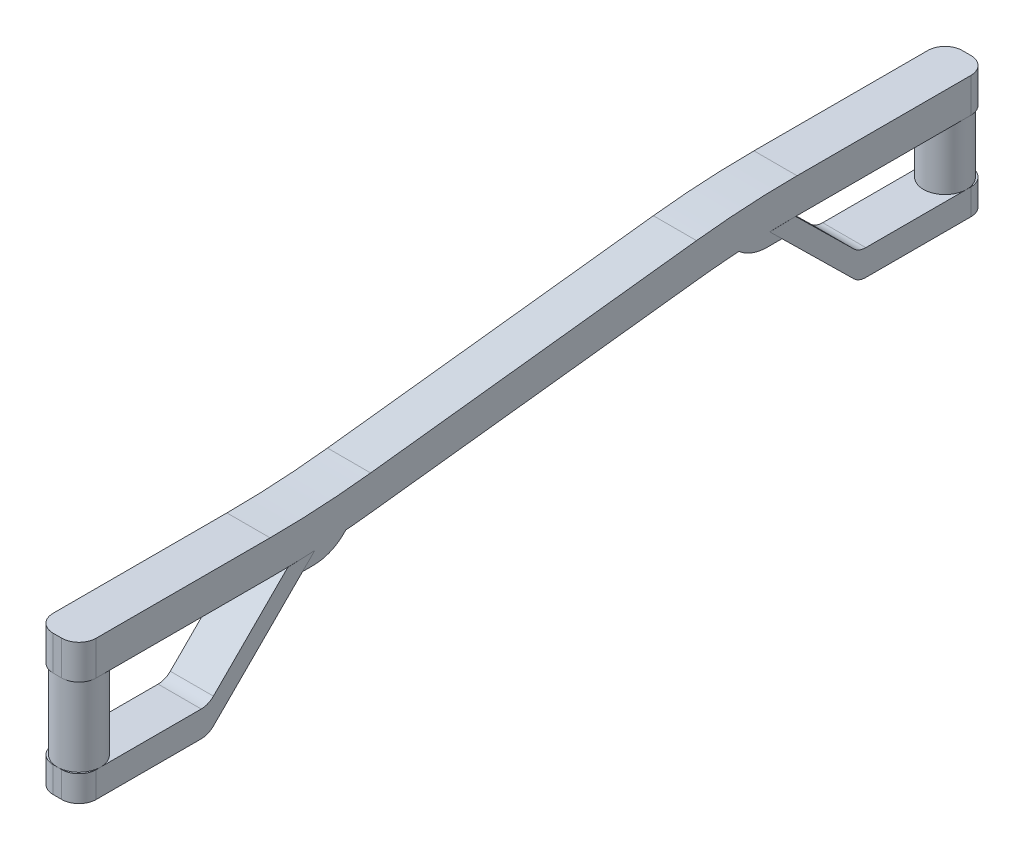
from build123d import *

# Parameters (mm, degrees)
SKETCH1_W             = 5
SKETCH1_H             = 105.4
BOSS_EXTRUDE1_DEPTH   = 4
SKETCH1_3_R           = 2.5
BOSS_EXTRUDE2_DEPTH   = 15
SKETCH1_4_R           = 2.5
BOSS_EXTRUDE3_DEPTH   = 7.2
FILLET1_R             = 1
CUT_EXTRUDE1_DEPTH    = 7
CUT_EXTRUDE2_DEPTH    = 7
BOSS_EXTRUDE4_DEPTH   = 5
CUT_EXTRUDE3_DEPTH    = 5
FILLET2_R             = 100
BOSS_EXTRUDE6_DEPTH   = 5
BOSS_EXTRUDE6_2_DEPTH = 5
BOSS_EXTRUDE7_DEPTH   = 5
FILLET3_R             = 5
FILLET4_R             = 2
FILLET5_R             = 2
FILLET6_R             = 2


with BuildPart() as part:
    # Sketch1 → Boss-Extrude1 (new body)
    with BuildSketch(Plane(origin=(0, 0, 0), x_dir=(1, 0, 0), z_dir=(0, 1, 0))):
        with Locations((-2.5, -52.7)):
            Rectangle(SKETCH1_W, SKETCH1_H)
    extrude(amount=BOSS_EXTRUDE1_DEPTH)

    # Sketch1<3> → Boss-Extrude2 (add)
    with BuildSketch(Plane(origin=(0, 0, 0), x_dir=(1, 0, 0), z_dir=(0, 1, 0))):
        with Locations(Location((-2.5, -102.9, 0), (0, 0, 270))):
            Circle(SKETCH1_3_R)
    extrude(amount=-BOSS_EXTRUDE2_DEPTH)

    # Sketch1<4> → Boss-Extrude3 (add)
    with BuildSketch(Plane(origin=(0, 0, 0), x_dir=(1, 0, 0), z_dir=(0, 1, 0))):
        with Locations(Location((-2.5, -2.5, 0), (0, 0, 270))):
            Circle(SKETCH1_4_R)
    extrude(amount=-BOSS_EXTRUDE3_DEPTH)

    # Fillet1
    fillet1_edges = [part.edges().sort_by_distance(p)[0] for p in [
        (0, 2, 105.4),
        (-5, 2, 105.4),
    ]]
    fillet(fillet1_edges, radius=FILLET1_R)

    # Sketch2 → Cut-Extrude1 (cut)
    with BuildSketch(Plane.XZ.offset(15)):
        Polygon((-1.833333333, 104.054700538), (-1.833333333, 101.745299462), (-3.833333333, 102.9), align=None)
    extrude(amount=-CUT_EXTRUDE1_DEPTH, mode=Mode.SUBTRACT)

    # Sketch3 → Cut-Extrude2 (cut)
    with BuildSketch(Plane(origin=(0, -7.2, 0), x_dir=(-1, 0, 0), z_dir=(0, -1, 0))):
        Polygon((3.166666667, -1.345299462), (3.166666667, -3.654700538), (1.166666667, -2.5), align=None)
    extrude(amount=-CUT_EXTRUDE2_DEPTH, mode=Mode.SUBTRACT)

    # Sketch4 → Boss-Extrude4 (add)
    with BuildSketch(Plane.ZY.offset(5)):
        Polygon((105.4, -5.8), (105.4, -1.8), (77.4, -1.8), (28, 4), (28, 0), (77.4, -5.8), align=None)
    extrude(amount=-BOSS_EXTRUDE4_DEPTH)

    # Sketch4<4> → Cut-Extrude3 (cut)
    with BuildSketch(Plane.ZY.offset(5)):
        Polygon((77.4, -1.8), (105.4, -1.8), (105.4, 4), (28, 4), align=None)
    extrude(amount=-CUT_EXTRUDE3_DEPTH, mode=Mode.SUBTRACT)

    # Fillet2
    fillet2_edges = [part.edges().sort_by_distance(p)[0] for p in [
        (-2.5, 4, 28),
        (-2.5, -1.8, 77.4),
        (-2.5, -5.8, 77.4),
        (-2.5, 0, 28),
    ]]
    fillet(fillet2_edges, radius=FILLET2_R)

    # Sketch6 → Boss-Extrude7 (add)
    with BuildSketch(Plane(origin=(0, 0, 0), x_dir=(0, 0, -1), z_dir=(1, 0, 0))):
        Polygon((-74.479709397, -5.414636547), (-78.065495835, -5.665495835), (-79.479709397, -7.079709397), (-74.479709397, -7.079709397), align=None)
        with BuildLine():
            ThreePointArc((-25.320806157, -0.050293893), (-27.108607835, -0.123032137), (-28.89482189, -0.227746249))
            Line((-28.89482189, -0.227746249), (-28.89482189, -1.452637955))
            Line((-28.89482189, -1.452637955), (-23.89482189, -1.452637955))
            Line((-23.89482189, -1.452637955), (-25.320806157, -0.050293893))
        make_face()
    extrude(amount=-BOSS_EXTRUDE7_DEPTH)

    # Fillet3
    # the kernel refuses this fillet: 5 mm, written as the material it takes off along each edge
    with BuildSketch(Plane(origin=(9.313384489, -7.079709397, 74.479709397), x_dir=(0, 1, 0), z_dir=(-1, 0, 0))) as fillet3_piece_1:
        with BuildLine():
            CenterArc((5, -3.725353796), FILLET3_R, 131.834823038, 48.165176962)
            Line((0, -3.725353796), (-0.1, -3.725353796))
            Line((-0.1, -3.725353796), (-0.1, 0))
            Line((-0.1, 0), (0, 0.1))
            ThreePointArc((0, 0.1), (0.832536425, 0.1), (1.598374307, 0.074507076))
            Line((1.598374307, 0.074507076), (1.66507285, 0))
        make_face()
    extrude(amount=23.626768978, mode=Mode.SUBTRACT)
    with BuildSketch(Plane(origin=(8.196248138, -1.452637955, 28.89482189), x_dir=(0, 1, 0), z_dir=(-1, 0, 0))) as fillet3_piece_2:
        with BuildLine():
            CenterArc((5, 3.278499255), FILLET3_R, 180, 40.972737691)
            Line((0, 3.278499255), (-0.1, 3.278499255))
            Line((-0.1, 3.278499255), (-0.1, 0))
            Line((-0.1, 0), (0, -0.1))
            ThreePointArc((0, -0.1), (0.612445853, -0.1), (1.14938954, -0.065569985))
            Line((1.14938954, -0.065569985), (1.224891706, 0))
        make_face()
    extrude(amount=21.392496276, mode=Mode.SUBTRACT)

    # Fillet5
    fillet5_edges = [part.edges().sort_by_distance(p)[0] for p in [
        (0, -3.8, 105.4),
        (-5, -3.8, 105.4),
        (0, 2, 0),
        (-5, 2, 0),
    ]]
    fillet(fillet5_edges, radius=FILLET5_R)


with BuildPart() as body_2:
    # Sketch5 → Boss-Extrude6 (new body)
    with BuildSketch(Plane(origin=(0, 0, 0), x_dir=(0, 0, -1), z_dir=(1, 0, 0))):
        Polygon((-90.4, -15), (-81.2, -5.8), (-78.065495835, -5.665495835), (-90.4, -18), (-105.4, -18), (-105.4, -15), align=None)
    extrude(amount=-BOSS_EXTRUDE6_DEPTH)

    # Fillet6
    fillet6_edges = [body_2.edges().sort_by_distance(p)[0] for p in [
        (-2.5, -18, 90.4),
        (-2.5, -15, 90.4),
        (-5, -16.5, 105.4),
        (0, -16.5, 105.4),
    ]]
    fillet(fillet6_edges, radius=FILLET6_R)


with BuildPart() as body_3:
    # Sketch5 → Boss-Extrude6 2 (new body)
    with BuildSketch(Plane(origin=(0, 0, 0), x_dir=(0, 0, -1), z_dir=(1, 0, 0))):
        Polygon((0, -7.2), (-15, -7.2), (-22.321225302, -0.000147195), (-25.320806157, -0.050293893), (-15, -10.2), (0, -10.2), align=None)
    extrude(amount=-BOSS_EXTRUDE6_2_DEPTH)

    # Fillet4
    fillet4_edges = [body_3.edges().sort_by_distance(p)[0] for p in [
        (-2.5, -7.2, 15),
        (-2.5, -10.2, 15),
        (-5, -8.7, 0),
        (0, -8.7, 0),
    ]]
    fillet(fillet4_edges, radius=FILLET4_R)


solid = Compound([part.part, body_2.part, body_3.part])
